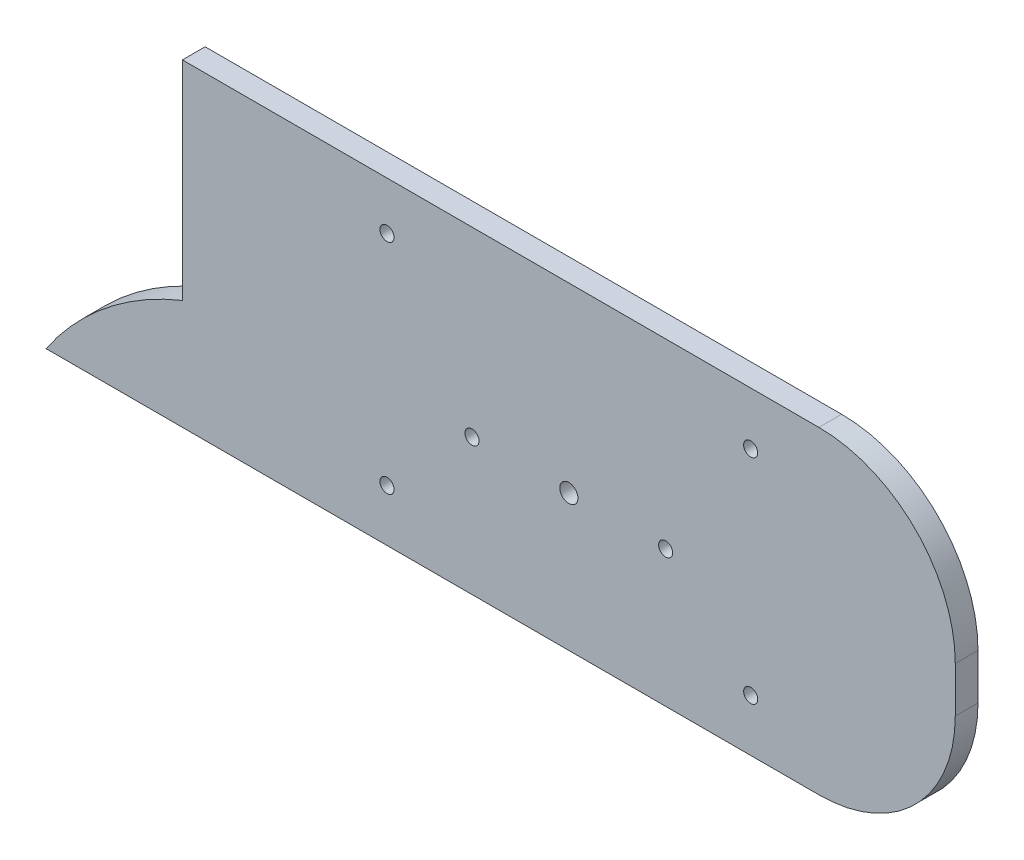
from build123d import *

# Parameters (mm, degrees)
BOSS_EXTRUDE1_DEPTH = 12.7
SKETCH3_R           = 3.937
CUT_EXTRUDE1_DEPTH  = 539.366167213
SKETCH4_R           = 5.08
SKETCH4_R_2         = 3.937
CUT_EXTRUDE2_DEPTH  = 539.366167213


with BuildPart() as part:
    # Sketch2 → Boss-Extrude1 (new body)
    with BuildSketch(Plane.XY):
        with BuildLine():
            Line((0, 0), (431.8, 0))
            ThreePointArc((431.8, 0), (485.681536726, 22.318463274), (508, 76.2))
            Line((508, 76.2), (508, 101.6))
            ThreePointArc((508, 101.6), (485.681536726, 155.481536726), (431.8, 177.8))
            Line((431.8, 177.8), (152.4, 177.8))
            Line((152.4, 177.8), (76.2, 177.8))
            Line((76.2, 177.8), (76.2, 61.401251199))
            ThreePointArc((76.2, 61.401251199), (33.506060073, 36.401783403), (0, 0))
        make_face()
    extrude(amount=BOSS_EXTRUDE1_DEPTH)

    # Sketch3 → Cut-Extrude1 (cut, through all)
    with BuildSketch(Plane(origin=(0, 0, 0), x_dir=(-1, 0, 0), z_dir=(0, 0, -1))):
        with Locations((-190.5, 29.082055279)):
            Circle(SKETCH3_R)
        with Locations((-393.7, 29.082055279)):
            Circle(SKETCH3_R)
        with Locations((-393.7, 148.336)):
            Circle(SKETCH3_R)
        with Locations((-190.5, 151.002055279)):
            Circle(SKETCH3_R)
    extrude(amount=-CUT_EXTRUDE1_DEPTH, mode=Mode.SUBTRACT)

    # Sketch4 → Cut-Extrude2 (cut, through all)
    with BuildSketch(Plane.XY.offset(12.7)):
        with Locations((292.1, 76.2)):
            Circle(SKETCH4_R)
        with Locations((237.998, 76.2)):
            Circle(SKETCH4_R_2)
        with Locations((346.202, 76.2)):
            Circle(SKETCH4_R_2)
    extrude(amount=-CUT_EXTRUDE2_DEPTH, mode=Mode.SUBTRACT)


solid = part.part
